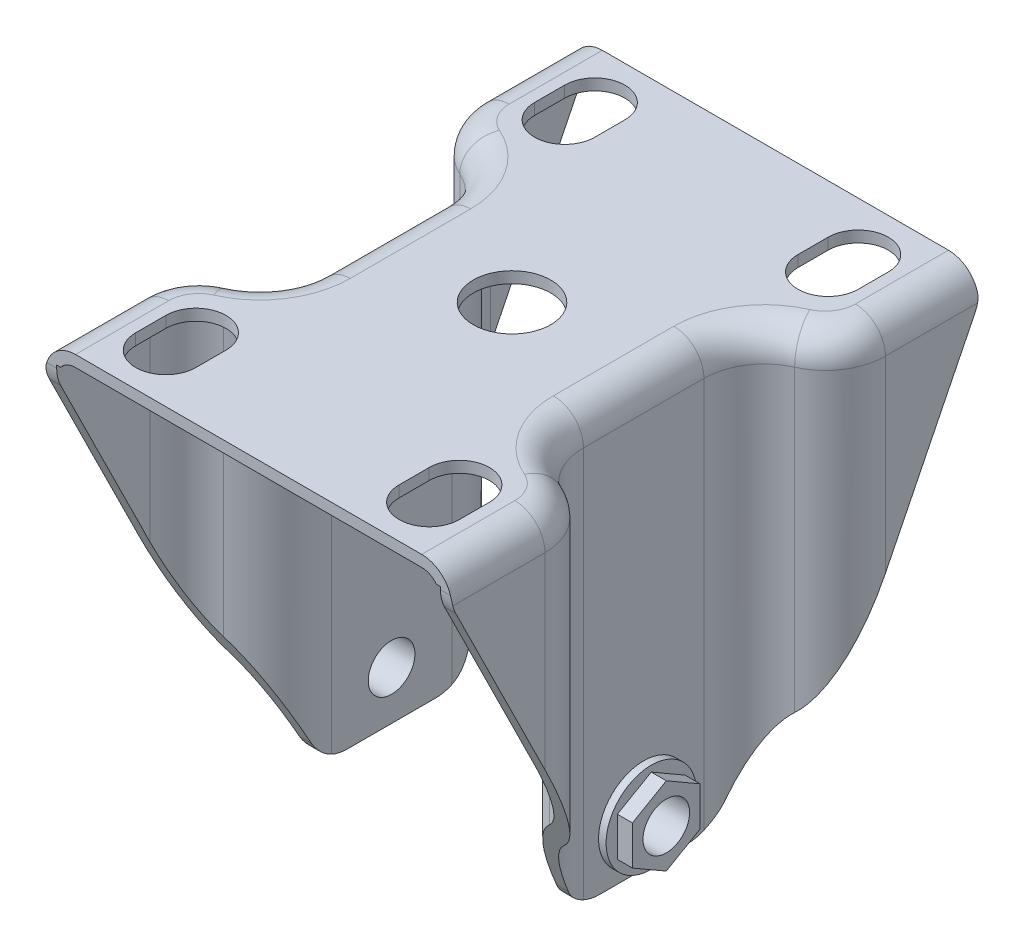
from build123d import *

# Parameters (mm, degrees)
BOSS_EXTRUDE1_DEPTH      = 27
BOSS_EXTRUDE1_DEPTH_BACK = 27
SKETCH1_R                = 3.1
SKETCH2_W                = 9.5
SKETCH2_H                = 32
CUT_EXTRUDE1_DEPTH       = 72.705558094
FILLET1_R                = 8
FILLET2_R                = 8
FILLET3_R                = 4
SHELL1_T                 = 1.5
CUT_EXTRUDE2_DEPTH       = 54
CUT_EXTRUDE3_START       = -54
CUT_EXTRUDE3_DEPTH       = 54
CUT_EXTRUDE4_DEPTH       = 54
FILLET4_R                = 5
SKETCH6_R                = 6
SKETCH6_R_2              = 3.1
BOSS_EXTRUDE2_DEPTH      = 1
SKETCH7_R                = 3.1
BOSS_EXTRUDE3_DEPTH      = 2
CUT_EXTRUDE5_DEPTH       = 2
SKETCH9_R                = 5.15
CUT_EXTRUDE6_DEPTH       = 2


with BuildPart() as part:
    # Sketch1 → Boss-Extrude1 (new, two sides: drawn at the far end of the back side and taken through both)
    with BuildSketch(Plane(origin=(0, 0, 0), x_dir=(0, 0, -1), z_dir=(1, 0, 0)).offset(-BOSS_EXTRUDE1_DEPTH_BACK)):
        with BuildLine():
            Line((-35, 50), (-35, 46))
            Line((-35, 46), (-10.37764638, -3.679959969))
            ThreePointArc((-10.37764638, -3.679959969), (-8.533805304, -5.708239), (-5.897688081, -6.459605574))
            Line((-5.897688081, -6.459605574), (5.897688081, -6.459605574))
            ThreePointArc((5.897688081, -6.459605574), (8.533805304, -5.708239), (10.37764638, -3.679959969))
            Line((10.37764638, -3.679959969), (35, 46))
            Line((35, 46), (35, 50))
            Line((35, 50), (-35, 50))
        make_face()
        Circle(SKETCH1_R, mode=Mode.SUBTRACT)
    extrude(amount=BOSS_EXTRUDE1_DEPTH + BOSS_EXTRUDE1_DEPTH_BACK)

    # Sketch2 → Cut-Extrude1 (cut, through all)
    with BuildSketch(Plane(origin=(0, 50, 0), x_dir=(1, 0, 0), z_dir=(0, 1, 0))):
        with Locations((-22.25, 0)):
            Rectangle(SKETCH2_W, SKETCH2_H)
        with Locations((22.25, 0)):
            Rectangle(SKETCH2_W, SKETCH2_H)
    extrude(amount=-CUT_EXTRUDE1_DEPTH, mode=Mode.SUBTRACT)

    # Fillet1
    fillet1_edges = [part.edges().sort_by_distance(p)[0] for p in [
        (-17.5, 28.832067194, -16),
    ]]
    fillet(fillet1_edges, radius=FILLET1_R)
    fillet1_2_edges = [part.edges().sort_by_distance(p)[0] for p in [
        (-17.5, 28.832067194, 16),
    ]]
    fillet(fillet1_2_edges, radius=FILLET1_R)
    fillet1_3_edges = [part.edges().sort_by_distance(p)[0] for p in [
        (17.5, 28.832067194, 16),
    ]]
    fillet(fillet1_3_edges, radius=FILLET1_R)
    fillet1_4_edges = [part.edges().sort_by_distance(p)[0] for p in [
        (17.5, 28.832067194, -16),
    ]]
    fillet(fillet1_4_edges, radius=FILLET1_R)

    # Fillet2
    fillet2_edges = [part.edges().sort_by_distance(p)[0] for p in [
        (-27, 28.832067194, 16),
        (-27, 28.832067194, -16),
        (27, 28.832067194, 16),
        (27, 28.832067194, -16),
    ]]
    fillet(fillet2_edges, radius=FILLET2_R)

    # Fillet3
    fillet3_edges = [part.edges().sort_by_distance(p)[0] for p in [
        (27, 50, -28.810095759),
        (25.708203932, 50, -18.261292574),
        (18.791796068, 50, -12.358898944),
        (17.5, 50, 0),
        (18.791796068, 50, 12.358898944),
        (25.708203932, 50, 18.261292574),
        (-27, 50, -28.810095759),
        (-25.708203932, 50, -18.261292574),
        (-18.791796068, 50, -12.358898944),
        (-17.5, 50, 0),
        (-18.791796068, 50, 12.358898944),
        (-25.708203932, 50, 18.261292574),
        (27, 50, 28.810095759),
        (-27, 50, 28.810095759),
    ]]
    fillet(fillet3_edges, radius=FILLET3_R)

    # Shell1 (no face opened: a closed hollow body)
    add(offset(amount=-SHELL1_T, mode=Mode.PRIVATE), mode=Mode.SUBTRACT)

    # Sketch3 → Cut-Extrude2 (cut)
    with BuildSketch(Plane.XZ.offset(6.459605574)):
        with BuildLine():
            Line((-25.5, 38.17967862), (-25.5, 22.620191517))
            ThreePointArc((-25.5, 22.620191517), (-24.450415695, 19.078586126), (-21.640625, 16.680738713))
            ThreePointArc((-21.640625, 16.680738713), (-17.827859994, 13.602523336), (-16.056401676, 9.033658891))
            ThreePointArc((-16.056401676, 9.033658891), (-16.014110899, 8.517598264), (-16, 8))
            Line((-16, 8), (-16, 5.897688081))
            Line((-16, 5.897688081), (-16, -5.897688081))
            Line((-16, -5.897688081), (-16, -8))
            ThreePointArc((-16, -8), (-16.014110899, -8.517598264), (-16.056401676, -9.033658891))
            ThreePointArc((-16.056401676, -9.033658891), (-17.827859994, -13.602523336), (-21.640625, -16.680738713))
            ThreePointArc((-21.640625, -16.680738713), (-24.450415695, -19.078586126), (-25.5, -22.620191517))
            Line((-25.5, -22.620191517), (-25.5, -38.549312108))
            Line((-25.5, -38.549312108), (25.5, -38.549312108))
            Line((25.5, -38.549312108), (25.5, -22.620191517))
            ThreePointArc((25.5, -22.620191517), (24.450415695, -19.078586126), (21.640625, -16.680738713))
            ThreePointArc((21.640625, -16.680738713), (17.827859994, -13.602523336), (16.056401676, -9.033658891))
            ThreePointArc((16.056401676, -9.033658891), (16.014110899, -8.517598264), (16, -8))
            Line((16, -8), (16, -5.897688081))
            Line((16, -5.897688081), (16, 5.897688081))
            Line((16, 5.897688081), (16, 8))
            ThreePointArc((16, 8), (16.014110899, 8.517598264), (16.056401676, 9.033658891))
            ThreePointArc((16.056401676, 9.033658891), (17.827859994, 13.602523336), (21.640625, 16.680738713))
            ThreePointArc((21.640625, 16.680738713), (24.450415695, 19.078586126), (25.5, 22.620191517))
            Line((25.5, 22.620191517), (25.5, 38.17967862))
            Line((25.5, 38.17967862), (-25.5, 38.17967862))
        make_face()
    extrude(amount=-CUT_EXTRUDE2_DEPTH, mode=Mode.SUBTRACT)

    # Sketch4 → Cut-Extrude3 (cut)
    with BuildSketch(Plane(origin=(0, 0, 33.5), x_dir=(-1, 0, 0), z_dir=(0, 0, -1)).offset(CUT_EXTRUDE3_START)):
        with BuildLine():
            Line((-24.969056884, 47.540394426), (24.969056884, 47.540394426))
            ThreePointArc((24.969056884, 47.540394426), (24.095220055, 48.247330201), (23, 48.5))
            Line((23, 48.5), (-23, 48.5))
            ThreePointArc((-23, 48.5), (-24.095220055, 48.247330201), (-24.969056884, 47.540394426))
        make_face()
    extrude(amount=CUT_EXTRUDE3_DEPTH, mode=Mode.SUBTRACT)

    # Sketch5 → Cut-Extrude4 (cut)
    with BuildSketch(Plane.XY.offset(-33.5)):
        with BuildLine():
            Line((-24.969056884, 47.540394426), (24.969056884, 47.540394426))
            ThreePointArc((24.969056884, 47.540394426), (24.095220055, 48.247330201), (23, 48.5))
            Line((23, 48.5), (-23, 48.5))
            ThreePointArc((-23, 48.5), (-24.095220055, 48.247330201), (-24.969056884, 47.540394426))
        make_face()
    extrude(amount=-CUT_EXTRUDE4_DEPTH, mode=Mode.SUBTRACT)

    # Fillet4
    fillet4_edges = [part.edges().sort_by_distance(p)[0] for p in [
        (-26.25, 46, -35),
        (26.25, 46, -35),
        (26.25, 46, 35),
        (-26.25, 46, 35),
    ]]
    fillet(fillet4_edges, radius=FILLET4_R)

    # Sketch6 → Boss-Extrude2 (add)
    with BuildSketch(Plane(origin=(17.5, 0, 0), x_dir=(0, 0, -1), z_dir=(1, 0, 0))):
        Circle(SKETCH6_R)
        Circle(SKETCH6_R_2, mode=Mode.SUBTRACT)
    boss_extrude2 = extrude(amount=BOSS_EXTRUDE2_DEPTH)

    # Mirror1: Boss-Extrude2 across plane
    add(boss_extrude2.mirror(Plane(origin=(0, 0, 0), x_dir=(0, 0, 1), z_dir=(1, 0, 0))))

    # Sketch7 → Boss-Extrude3 (add)
    with BuildSketch(Plane(origin=(18.5, 0, 0), x_dir=(0, 0, -1), z_dir=(1, 0, 0))):
        Polygon((0, 5.196152423), (-4.5, 2.598076211), (-4.5, -2.598076211), (0, -5.196152423), (4.5, -2.598076211), (4.5, 2.598076211), align=None)
        Circle(SKETCH7_R, mode=Mode.SUBTRACT)
    boss_extrude3 = extrude(amount=BOSS_EXTRUDE3_DEPTH)

    # Mirror2: Boss-Extrude3 across plane
    add(boss_extrude3.mirror(Plane(origin=(0, 0, 0), x_dir=(0, 0, 1), z_dir=(1, 0, 0))))

    # Sketch8 → Cut-Extrude5 (cut)
    with BuildSketch(Plane(origin=(0, 50, 0), x_dir=(1, 0, 0), z_dir=(0, 1, 0))):
        with BuildLine():
            Line((-21.5, 24.5), (-21.5, 28.5))
            ThreePointArc((-21.5, 28.5), (-17.5, 32.5), (-13.5, 28.5))
            Line((-13.5, 28.5), (-13.5, 24.5))
            ThreePointArc((-13.5, 24.5), (-17.5, 20.5), (-21.5, 24.5))
        make_face()
        with BuildLine():
            Line((13.5, 24.5), (13.5, 28.5))
            ThreePointArc((13.5, 28.5), (17.5, 32.5), (21.5, 28.5))
            Line((21.5, 28.5), (21.5, 24.5))
            ThreePointArc((21.5, 24.5), (17.5, 20.5), (13.5, 24.5))
        make_face()
    cut_extrude5 = extrude(amount=-CUT_EXTRUDE5_DEPTH, mode=Mode.SUBTRACT)

    # Mirror3: Cut-Extrude5 across plane
    add(cut_extrude5.mirror(Plane.XY), mode=Mode.SUBTRACT)

    # Sketch9 → Cut-Extrude6 (cut)
    with BuildSketch(Plane(origin=(0, 50, 0), x_dir=(1, 0, 0), z_dir=(0, 1, 0))):
        Circle(SKETCH9_R)
    extrude(amount=-CUT_EXTRUDE6_DEPTH, mode=Mode.SUBTRACT)


solid = part.part
